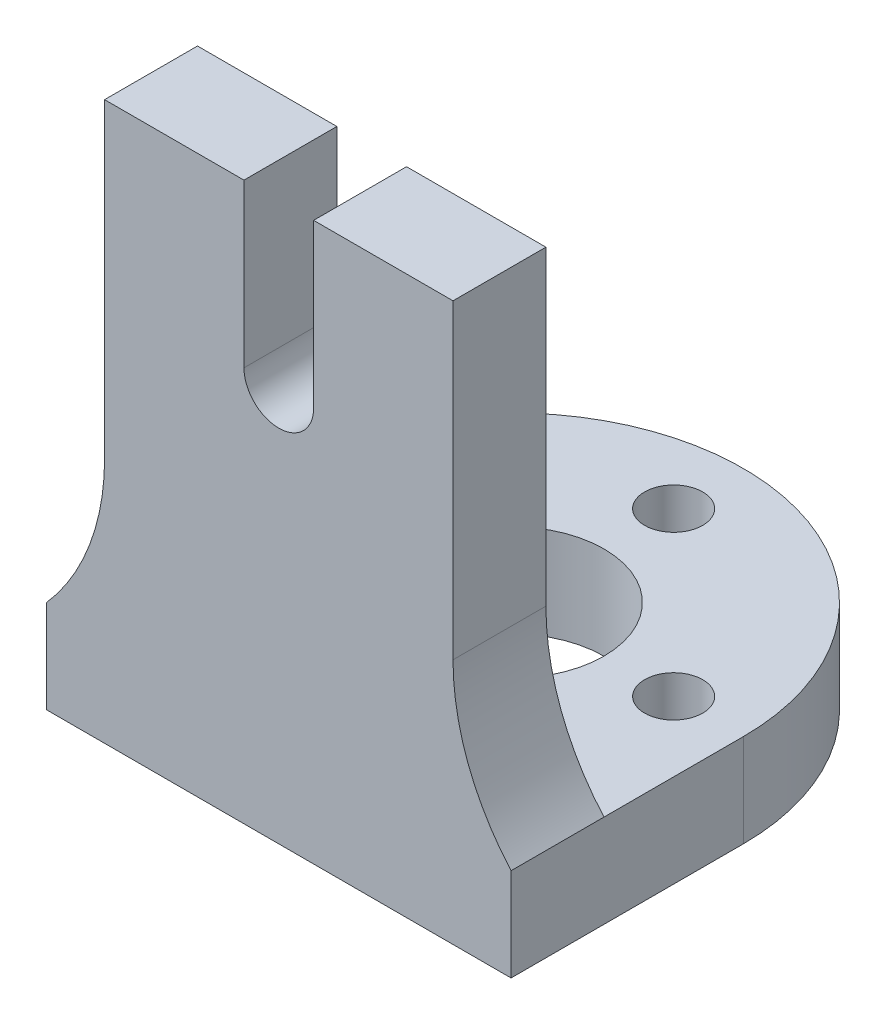
from build123d import *

# Parameters (mm, degrees)
BOSS_EXTRUDE1_DEPTH = 4
SKETCH3_R           = 4
SKETCH3_R_2         = 1.25
CUT_EXTRUDE1_DEPTH  = 4
SKETCH4_W           = 20
SKETCH4_H           = 4
BOSS_EXTRUDE2_DEPTH = 20
SKETCH5_R           = 1.5
CUT_EXTRUDE2_DEPTH  = 30
SKETCH6_R           = 3.25
CUT_EXTRUDE3_DEPTH  = 1
SKETCH7_W           = 2.5
SKETCH7_H           = 20
CUT_EXTRUDE4_DEPTH  = 4
FILLET1_R           = 10


with BuildPart() as part:
    # Sketch1 → Boss-Extrude1 (new body)
    with BuildSketch(Plane(origin=(0, 0, 0), x_dir=(1, 0, 0), z_dir=(0, 1, 0))):
        with BuildLine():
            Line((-10, -10), (10, -10))
            Line((10, -10), (10, 0))
            ThreePointArc((10, 0), (0, 10), (-10, 0))
            Line((-10, 0), (-10, -10))
        make_face()
    extrude(amount=BOSS_EXTRUDE1_DEPTH)

    # Sketch3 → Cut-Extrude1 (cut)
    with BuildSketch(Plane(origin=(0, 4, 0), x_dir=(1, 0, 0), z_dir=(0, 1, 0))):
        with Locations(Location((0, 0, 0), (0, 0, 270))):
            Circle(SKETCH3_R)
        with Locations(Location((0, 7, 0), (0, 0, 270))):
            Circle(SKETCH3_R_2)
        with Locations(Location((7, 0, 0), (0, 0, 270))):
            Circle(SKETCH3_R_2)
        with Locations(Location((0, -7, 0), (0, 0, 270))):
            Circle(SKETCH3_R_2)
        with Locations(Location((-7, 0, 0), (0, 0, 270))):
            Circle(SKETCH3_R_2)
    extrude(amount=-CUT_EXTRUDE1_DEPTH, mode=Mode.SUBTRACT)

    # Sketch4 → Boss-Extrude2 (add)
    with BuildSketch(Plane(origin=(0, 4, 0), x_dir=(1, 0, 0), z_dir=(0, 1, 0))):
        with Locations((0, -8)):
            Rectangle(SKETCH4_W, SKETCH4_H)
    extrude(amount=BOSS_EXTRUDE2_DEPTH)

    # Sketch5 → Cut-Extrude2 (cut)
    with BuildSketch(Plane(origin=(0, 0, 6), x_dir=(-1, 0, 0), z_dir=(0, 0, -1))):
        with BuildLine():
            Line((-1.5, 24), (-1.5, 17))
            ThreePointArc((-1.5, 17), (0, 18.5), (1.5, 17))
            Line((1.5, 17), (1.5, 24))
            Line((1.5, 24), (-1.5, 24))
        make_face()
        with Locations((0, 17)):
            Circle(SKETCH5_R)
    extrude(amount=-CUT_EXTRUDE2_DEPTH, mode=Mode.SUBTRACT)

    # Sketch6 → Cut-Extrude3 (cut)
    with BuildSketch(Plane(origin=(0, 0, 6), x_dir=(-1, 0, 0), z_dir=(0, 0, -1))):
        with Locations((0, 17)):
            Circle(SKETCH6_R)
    extrude(amount=-CUT_EXTRUDE3_DEPTH, mode=Mode.SUBTRACT)

    # Sketch7 → Cut-Extrude4 (cut)
    with BuildSketch(Plane(origin=(0, 0, 6), x_dir=(-1, 0, 0), z_dir=(0, 0, -1))):
        with Locations((8.75, 14)):
            Rectangle(SKETCH7_W, SKETCH7_H)
        with Locations((-8.75, 14)):
            Rectangle(SKETCH7_W, SKETCH7_H)
    extrude(amount=-CUT_EXTRUDE4_DEPTH, mode=Mode.SUBTRACT)

    # Fillet1
    # the kernel refuses this fillet: 10 mm, written as the material it adds along each edge
    with BuildSketch(Plane(origin=(7.5, 4, 6), x_dir=(0, 1, 0), z_dir=(0, 0, 1))) as fillet1_piece_1:
        with BuildLine():
            CenterArc((6.614378278, -10), FILLET1_R, 90, 41.409622109)
            Line((0, -2.5), (0, 0))
            Line((0, 0), (6.614378278, 0))
        make_face()
    extrude(amount=4)
    with BuildSketch(Plane(origin=(-7.5, 4, 6), x_dir=(0, 1, 0), z_dir=(0, 0, 1))) as fillet1_piece_2:
        with BuildLine():
            CenterArc((6.614378278, 10), FILLET1_R, 228.590377891, 41.409622109)
            Line((0, 2.5), (0, 0))
            Line((0, 0), (6.614378278, 0))
        make_face()
    extrude(amount=4)


solid = part.part
